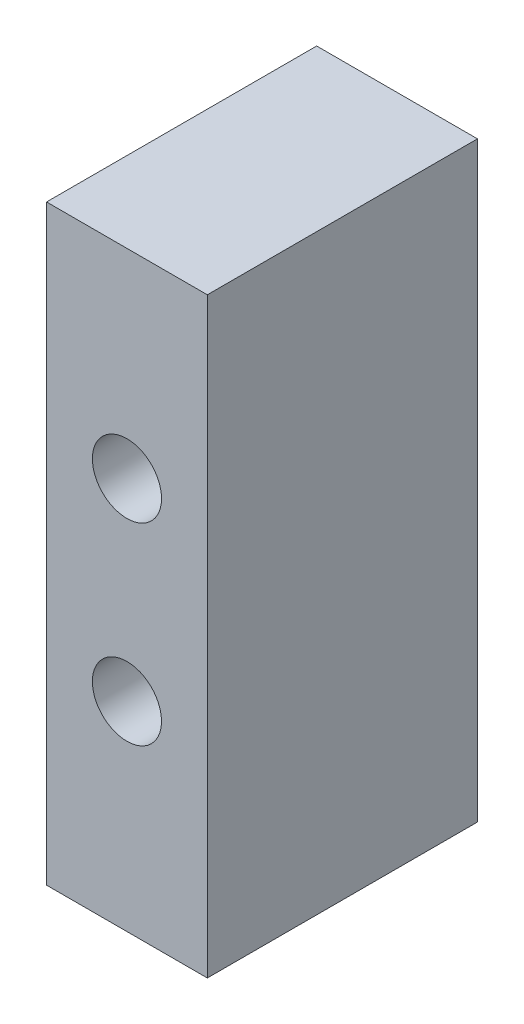
from build123d import *

# Parameters (mm, degrees)
SKETCH_1_W      = 10
SKETCH_1_H      = 36.8
SKETCH_1_R      = 2.15
EXTRUDE_1_DEPTH = 16.8


with BuildPart() as part:
    # 草图1 → 凸台-拉伸1 (new body)
    with BuildSketch(Plane.XY):
        Rectangle(SKETCH_1_W, SKETCH_1_H)
        with Locations((0, 6)):
            Circle(SKETCH_1_R, mode=Mode.SUBTRACT)
        with Locations((0, -6)):
            Circle(SKETCH_1_R, mode=Mode.SUBTRACT)
    extrude(amount=EXTRUDE_1_DEPTH)


solid = part.part
